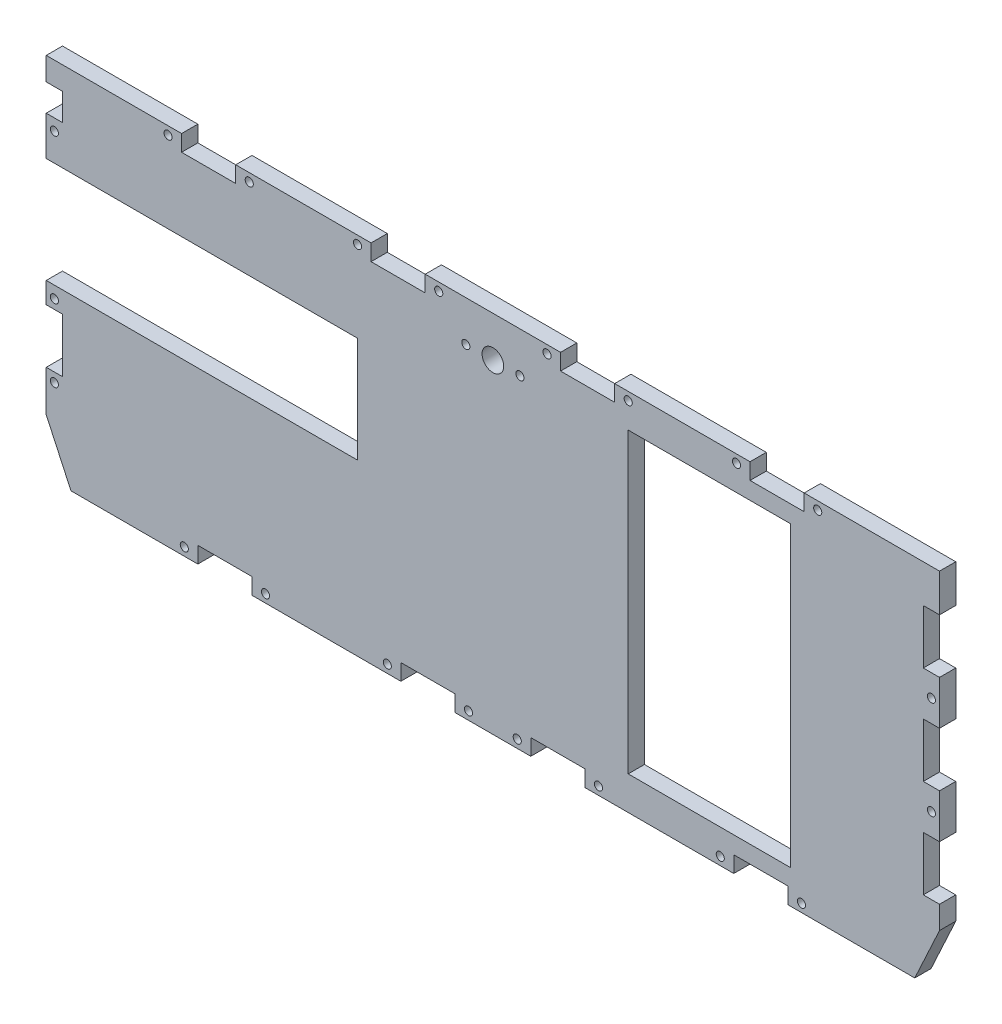
from build123d import *

# Parameters (mm, degrees)
BOSS_EXTRU_1_DEPTH      = 6
ESQUISSE3_W             = 6
ESQUISSE3_H             = 20
ESQUISSE3_H_2           = 10
ESQUISSE3_W_2           = 20
ESQUISSE3_H_3           = 6
ESQUISSE3_W_3           = 60
ESQUISSE3_H_4           = 110
ESQUISSE3_W_4           = 115
ESQUISSE3_H_5           = 39
ENL_V_MAT_EXTRU_2_DEPTH = 6
ESQUISSE4_R             = 1.5
ESQUISSE4_R_2           = 4
ENL_V_MAT_EXTRU_3_DEPTH = 6
ESQUISSE5_W             = 456.045253014
ESQUISSE5_H             = 136.228984631
ENL_V_MAT_EXTRU_4_DEPTH = 6


with BuildPart() as part:
    # Esquisse1 → Boss.-Extru.1 (new body)
    with BuildSketch(Plane.XY):
        Polygon((-165, 96.73), (165, 96.73), (165, -18.27), (123, -109.022410436), (-123, -109.022410436), (-165, -18.27), align=None)
    extrude(amount=BOSS_EXTRU_1_DEPTH)

    # Esquisse3 → Enlèv. mat.-Extru.2 (cut)
    with BuildSketch(Plane(origin=(0, 0, 0), x_dir=(-1, 0, 0), z_dir=(0, 0, -1))):
        with Locations((162, 6.94)):
            Rectangle(ESQUISSE3_W, ESQUISSE3_H)
        with Locations((162, 83.23258956)):
            Rectangle(ESQUISSE3_W, ESQUISSE3_H_2)
        with Locations((-24, -35.02)):
            Rectangle(ESQUISSE3_W_2, ESQUISSE3_H_3)
        with Locations((99, -35.02)):
            Rectangle(ESQUISSE3_W_2, ESQUISSE3_H_3)
        with Locations((-80, 29.355)):
            Rectangle(ESQUISSE3_W_3, ESQUISSE3_H_4)
        with Locations((-162, 72.73)):
            Rectangle(ESQUISSE3_W, ESQUISSE3_H)
        with Locations((24, -35.02)):
            Rectangle(ESQUISSE3_W_2, ESQUISSE3_H_3)
        with Locations((-162, 36.44)):
            Rectangle(ESQUISSE3_W, ESQUISSE3_H)
        with Locations((-162, 0.15)):
            Rectangle(ESQUISSE3_W, ESQUISSE3_H)
        with Locations((105, 93.73)):
            Rectangle(ESQUISSE3_W_2, ESQUISSE3_H_3)
        with Locations((-35, 93.73)):
            Rectangle(ESQUISSE3_W_2, ESQUISSE3_H_3)
        with Locations((35, 93.73)):
            Rectangle(ESQUISSE3_W_2, ESQUISSE3_H_3)
        with Locations((-105, 93.73)):
            Rectangle(ESQUISSE3_W_2, ESQUISSE3_H_3)
        with Locations((107.5, 44.23)):
            Rectangle(ESQUISSE3_W_4, ESQUISSE3_H_5)
        with Locations((-99, -35.02)):
            Rectangle(ESQUISSE3_W_2, ESQUISSE3_H_3)
    extrude(amount=-ENL_V_MAT_EXTRU_2_DEPTH, mode=Mode.SUBTRACT)

    # Esquisse4 → Enlèv. mat.-Extru.3 (cut)
    with BuildSketch(Plane(origin=(0, 0, 0), x_dir=(-1, 0, 0), z_dir=(0, 0, -1))):
        with Locations((162, 20.335)):
            Circle(ESQUISSE4_R)
        with Locations((114, -35.02)):
            Circle(ESQUISSE4_R)
        with Locations((162, 73.98258956)):
            Circle(ESQUISSE4_R)
        with Locations((84, -35.02)):
            Circle(ESQUISSE4_R)
        with Locations((39, -35.02)):
            Circle(ESQUISSE4_R)
        with Locations((162, -6.46)):
            Circle(ESQUISSE4_R)
        with Locations((9, -35.02)):
            Circle(ESQUISSE4_R)
        with Locations((-9, -35.02)):
            Circle(ESQUISSE4_R)
        with Locations((-39, -35.02)):
            Circle(ESQUISSE4_R)
        with Locations((-84, -35.02)):
            Circle(ESQUISSE4_R)
        with Locations((120, 93.73)):
            Circle(ESQUISSE4_R)
        with Locations((-114, -35.02)):
            Circle(ESQUISSE4_R)
        with Locations((90, 93.73)):
            Circle(ESQUISSE4_R)
        with Locations((0, 81.73)):
            Circle(ESQUISSE4_R_2)
        with Locations((50, 93.73)):
            Circle(ESQUISSE4_R)
        with Locations((20, 93.73)):
            Circle(ESQUISSE4_R)
        with Locations((-162, 18.29)):
            Circle(ESQUISSE4_R)
        with Locations((-162, 54.585)):
            Circle(ESQUISSE4_R)
        with Locations((-20, 93.73)):
            Circle(ESQUISSE4_R)
        with Locations((-50, 93.73)):
            Circle(ESQUISSE4_R)
        with Locations((-90, 93.73)):
            Circle(ESQUISSE4_R)
        with Locations((-120, 93.73)):
            Circle(ESQUISSE4_R)
        with Locations((-10, 81.73)):
            Circle(ESQUISSE4_R)
        with Locations((10, 81.73)):
            Circle(ESQUISSE4_R)
    extrude(amount=-ENL_V_MAT_EXTRU_3_DEPTH, mode=Mode.SUBTRACT)

    # Esquisse5 → Enlèv. mat.-Extru.4 (cut)
    with BuildSketch(Plane(origin=(0, 0, 0), x_dir=(-1, 0, 0), z_dir=(0, 0, -1))):
        with Locations((-18.307092018, -106.134492316)):
            Rectangle(ESQUISSE5_W, ESQUISSE5_H)
    extrude(amount=-ENL_V_MAT_EXTRU_4_DEPTH, mode=Mode.SUBTRACT)


solid = part.part
